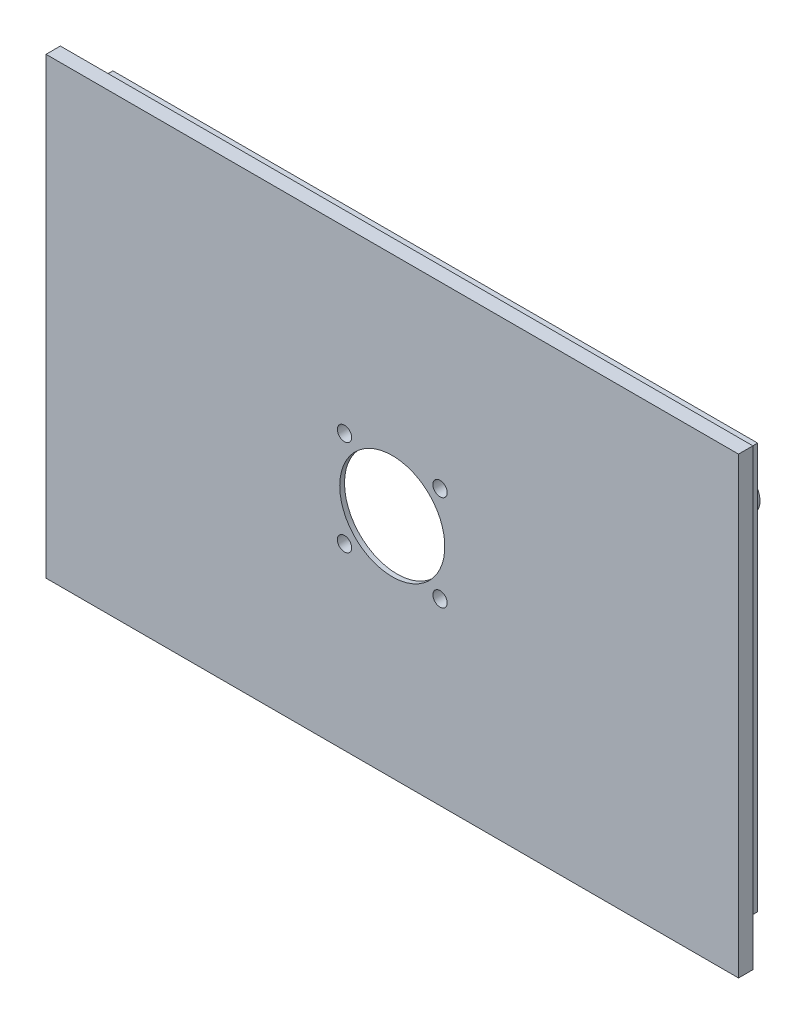
from build123d import *

# Parameters (mm, degrees)
ESBO_O1_W                = 150
ESBO_O1_H                = 100
RESSALTO_EXTRUS_O1_DEPTH = 3
ESBO_O1_3_W              = 135
ESBO_O1_3_H              = 85
ESBO_O1_3_W_2            = 130
ESBO_O1_3_H_2            = 80
RESSALTO_EXTRUS_O2_DEPTH = 6
ESBO_O2_R                = 4
RESSALTO_EXTRUS_O3_DEPTH = 15
ESBO_O3_R                = 1.75
CORTE_EXTRUS_O1_DEPTH    = 8
ESBO_O4_W                = 14
ESBO_O4_H                = 1.980707968
RESSALTO_EXTRUS_O4_DEPTH = 2
ESBO_O5_R                = 11
ESBO_O5_R_2              = 1.5
CORTE_EXTRUS_O2_DEPTH    = 10
CHANFRO1_SIZE            = 2
CHANFRO1_SIZE_2          = 2.965121937
ESBO_O6_W                = 150
ESBO_O6_H                = 100
ESBO_O6_W_2              = 145
ESBO_O6_H_2              = 95
CORTE_EXTRUS_O3_DEPTH    = 10


with BuildPart() as part:
    # Esboço1 → Ressalto-extrusão1 (new body)
    with BuildSketch(Plane.XY):
        with Locations((75, 50)):
            Rectangle(ESBO_O1_W, ESBO_O1_H)
    extrude(amount=RESSALTO_EXTRUS_O1_DEPTH)

    # Esboço1<3> → Ressalto-extrusão2 (add)
    with BuildSketch(Plane.XY):
        with Locations((75, 50)):
            Rectangle(ESBO_O1_3_W, ESBO_O1_3_H)
        with Locations((75, 50)):
            Rectangle(ESBO_O1_3_W_2, ESBO_O1_3_H_2, mode=Mode.SUBTRACT)
    extrude(amount=-RESSALTO_EXTRUS_O2_DEPTH)

    # Esboço2 → Ressalto-extrusão3 (add)
    with BuildSketch(Plane(origin=(0, 0, 0), x_dir=(-1, 0, 0), z_dir=(0, 0, -1))):
        with Locations((-130, 73.25)):
            Circle(ESBO_O2_R)
        with Locations((-32, 76.75)):
            Circle(ESBO_O2_R)
        with Locations((-28, 25.75)):
            Circle(ESBO_O2_R)
        with Locations((-124, 23.25)):
            Circle(ESBO_O2_R)
    extrude(amount=RESSALTO_EXTRUS_O3_DEPTH)

    # Esboço3 → Corte-extrusão1 (cut)
    with BuildSketch(Plane(origin=(0, 0, -15), x_dir=(-1, 0, 0), z_dir=(0, 0, -1))):
        with Locations((-130, 73.25)):
            Circle(ESBO_O3_R)
        with Locations((-32, 76.75)):
            Circle(ESBO_O3_R)
        with Locations((-28, 25.75)):
            Circle(ESBO_O3_R)
        with Locations((-124, 23.25)):
            Circle(ESBO_O3_R)
    extrude(amount=-CORTE_EXTRUS_O1_DEPTH, mode=Mode.SUBTRACT)

    # Esboço4 → Ressalto-extrusão4 (add)
    with BuildSketch(Plane(origin=(0, 0, 0), x_dir=(-1, 0, 0), z_dir=(0, 0, -1))):
        with Locations((-75, 84.770026355)):
            Rectangle(ESBO_O4_W, ESBO_O4_H)
    extrude(amount=RESSALTO_EXTRUS_O4_DEPTH)

    # Esboço5 → Corte-extrusão2 (cut)
    with BuildSketch(Plane(origin=(0, 0, 0), x_dir=(-1, 0, 0), z_dir=(0, 0, -1))):
        with Locations((-75, 50)):
            Circle(ESBO_O5_R)
        with Locations((-85, 60)):
            Circle(ESBO_O5_R_2)
        with Locations((-65, 40)):
            Circle(ESBO_O5_R_2)
        with Locations((-85, 40)):
            Circle(ESBO_O5_R_2)
        with Locations((-65, 60)):
            Circle(ESBO_O5_R_2)
    extrude(amount=-CORTE_EXTRUS_O2_DEPTH, mode=Mode.SUBTRACT)

    # Chanfro1
    # the kernel refuses this chamfer: 2.965121937, 2 mm, written as the material it takes off along each edge
    with BuildSketch(Plane(origin=(75, 50, 0), x_dir=(-1, 0, 0), z_dir=(0, -1, 0))) as chanfro1_piece_1:
        Polygon((11, -CHANFRO1_SIZE), (11 + CHANFRO1_SIZE_2, 0), (11, 0), align=None)
    revolve(axis=Axis((75, 50, 0), (0, 0, -1)), mode=Mode.SUBTRACT)

    # Esboço6 → Corte-extrusão3 (cut)
    with BuildSketch(Plane(origin=(0, 0, 0), x_dir=(-1, 0, 0), z_dir=(0, 0, -1))):
        with Locations((-75, 50)):
            Rectangle(ESBO_O6_W, ESBO_O6_H)
        with Locations((-75, 50)):
            Rectangle(ESBO_O6_W_2, ESBO_O6_H_2, mode=Mode.SUBTRACT)
    extrude(amount=-CORTE_EXTRUS_O3_DEPTH, mode=Mode.SUBTRACT)


solid = part.part
